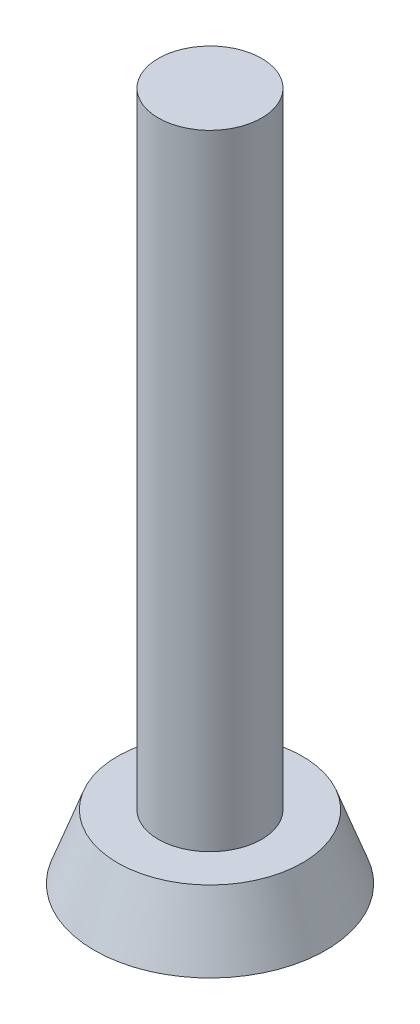
from build123d import *

# Parameters (mm, degrees)
SKETCH1_R           = 3.36
BOSS_EXTRUDE1_DEPTH = 1.86
BOSS_EXTRUDE1_TAPER = 20
SKETCH2_R           = 1.5
BOSS_EXTRUDE2_DEPTH = 18.14
CUT_EXTRUDE1_DEPTH  = 1.5


with BuildPart() as part:
    # Sketch1 → Boss-Extrude1 (new body)
    with BuildSketch(Plane(origin=(0, 0, 0), x_dir=(1, 0, 0), z_dir=(0, 1, 0))):
        Circle(SKETCH1_R)
    extrude(amount=BOSS_EXTRUDE1_DEPTH, taper=BOSS_EXTRUDE1_TAPER)

    # Sketch2 → Boss-Extrude2 (add)
    with BuildSketch(Plane(origin=(0, 1.86, 0), x_dir=(1, 0, 0), z_dir=(0, 1, 0))):
        Circle(SKETCH2_R)
    extrude(amount=BOSS_EXTRUDE2_DEPTH)

    # Sketch3 → Cut-Extrude1 (cut)
    with BuildSketch(Plane.XZ):
        Polygon((0, 1.154700538), (-1, 0.577350269), (-1, -0.577350269), (0, -1.154700538), (1, -0.577350269), (1, 0.577350269), align=None)
    extrude(amount=-CUT_EXTRUDE1_DEPTH, mode=Mode.SUBTRACT)


solid = part.part
